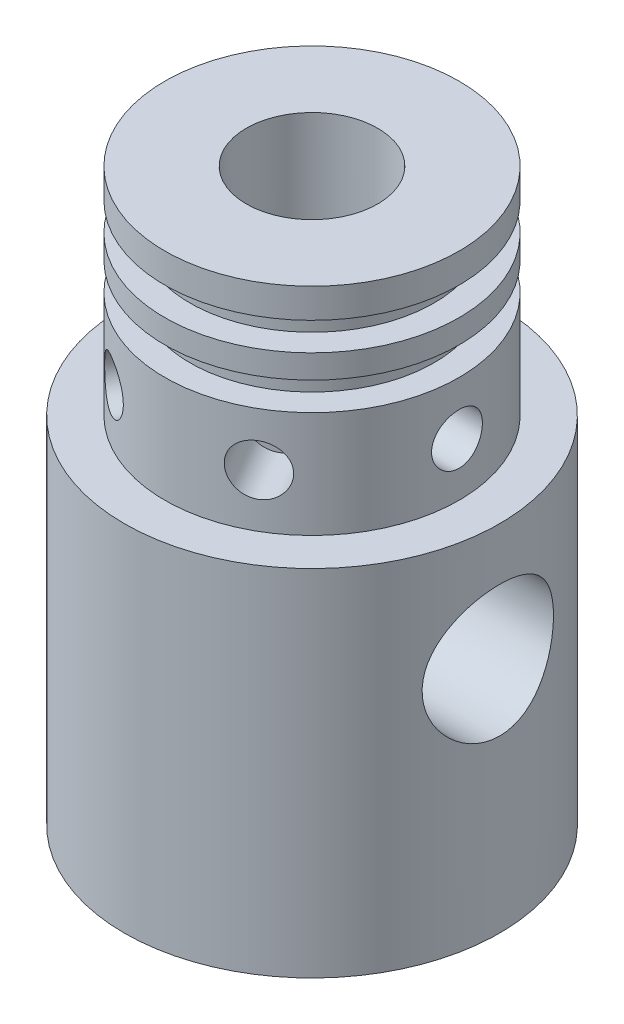
from build123d import *

# Parameters (mm, degrees)
CUT_EXTRUDE1_DEPTH      = 30.496372261
CUT_EXTRUDE1_DEPTH_BACK = 30.496372261
SKETCH2_R               = 5.55625
CUT_EXTRUDE2_REACH      = 46.363
SKETCH3_R               = 5.55625
SKETCH4_R               = 2.15
CUT_EXTRUDE3_DEPTH      = 5
CIRPATTERN1_COUNT       = 6
SKETCH5_R               = 15.875
BOSS_EXTRUDE1_DEPTH     = 10


with BuildPart() as part:
    # Sketch1 → Revolve1 (revolve)
    with BuildSketch(Plane.XY):
        Polygon((0, -19.13125), (15.875, -19.13125), (15.875, 0.86875), (12.45, 0.86875), (12.45, 9.86875), (10.31875, 9.86875), (10.31875, 12.25), (12.45, 12.25), (12.45, 14.25), (10.31875, 14.25), (10.31875, 16.63125), (12.45, 16.63125), (12.45, 19.13125), (0, 19.13125), align=None)
    revolve(axis=Axis((0, -8.095014715, 0), (0, 1, 0)))

    # Sketch2 → Cut-Extrude1 (cut, two sides: drawn at the far end of the back side and taken through both)
    with BuildSketch(Plane(origin=(0, 0, 0), x_dir=(0, 0, -1), z_dir=(1, 0, 0)).offset(-CUT_EXTRUDE1_DEPTH_BACK)):
        with Locations((0, -9.13125)):
            Circle(SKETCH2_R)
    extrude(amount=CUT_EXTRUDE1_DEPTH + CUT_EXTRUDE1_DEPTH_BACK, mode=Mode.SUBTRACT)

    # Sketch3 → Cut-Extrude2 (cut, up to next)
    with BuildSketch(Plane(origin=(0, 19.13125, 0), x_dir=(1, 0, 0), z_dir=(0, 1, 0)), mode=Mode.PRIVATE) as cut_extrude2_sk1:
        Circle(SKETCH3_R)
    cut_extrude2_tool1 = extrude(cut_extrude2_sk1.sketch, amount=-CUT_EXTRUDE2_REACH, mode=Mode.PRIVATE) & part.part
    add(cut_extrude2_tool1.solids().sort_by_distance((0, 19.13125, 0))[0], mode=Mode.SUBTRACT)

    # Sketch4 → Cut-Extrude3 (cut)
    with BuildSketch(Plane(origin=(12.45, 0, 0), x_dir=(0, 0, -1), z_dir=(1, 0, 0))):
        with Locations((0, 5.36875)):
            Circle(SKETCH4_R)
    cut_extrude3 = extrude(amount=-CUT_EXTRUDE3_DEPTH, mode=Mode.SUBTRACT)

    # CirPattern1: Cut-Extrude3 ×6 about axis
    cirpattern1_axis = Axis((0, -8.095014715, 0), (0, -1, 0))
    for i in range(1, CIRPATTERN1_COUNT):
        add(cut_extrude3.rotate(cirpattern1_axis, i * 360 / CIRPATTERN1_COUNT), mode=Mode.SUBTRACT)

    # Sketch5 → Boss-Extrude1 (add)
    with BuildSketch(Plane.XZ.offset(19.13125)):
        Circle(SKETCH5_R)
    extrude(amount=BOSS_EXTRUDE1_DEPTH)


solid = part.part
